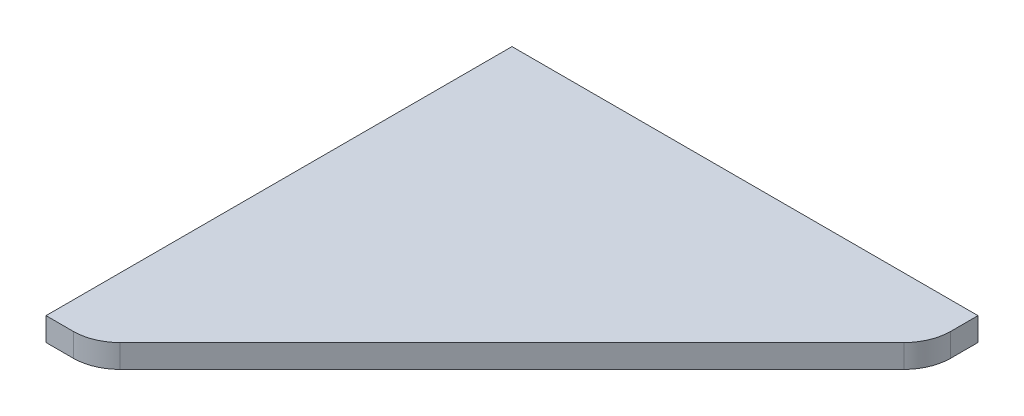
from build123d import *

# Parameters (mm, degrees)
SKETCH2_W                      = 304.8
SKETCH2_H                      = 304.8
BOSS_EXTRUDE1_DEPTH            = 3.175
CUT_EXTRUDE1_DEPTH             = 348.408852067
CUT_EXTRUDE1_DEPTH_BACK        = 348.408852067
SKETCH3_W                      = 304.8
SKETCH3_H                      = 304.8
SKETCH3_R                      = 12.7
SKETCH3_R_2                    = 8.89
BODY_DELETE_KEEP_1_OUTLINE_R   = 12.7
BODY_DELETE_KEEP_1_OUTLINE_R_2 = 8.89
BODY_DELETE_KEEP_1_DEPTH       = 3.175


# Read off the part's stored shape, not the designer's step: Body-Delete/Keep 1
with BuildPart() as part:
    # Sketch2 → Boss-Extrude1 (new body)
    with BuildSketch(Plane(origin=(0, 0, 0), x_dir=(1, 0, 0), z_dir=(0, 1, 0))):
        with Locations((-56.763509666, -124.968808797)):
            Rectangle(SKETCH2_W, SKETCH2_H)
    extrude(amount=BOSS_EXTRUDE1_DEPTH)

    # Sketch3 → Cut-Extrude1 (cut, two sides: drawn at the far end of the back side and taken through both)
    # profile 1 of 3: a face of its own
    with BuildSketch(Plane(origin=(0, 3.175, 0), x_dir=(1, 0, 0), z_dir=(0, 1, 0)).offset(-CUT_EXTRUDE1_DEPTH_BACK)):
        with Locations((-56.763509666, -124.968808797)):
            Rectangle(SKETCH3_W, SKETCH3_H)
        Polygon((-188.253637726, -268.695366412), (-192.063637726, -268.695366412), (-192.063637726, -265.393366412), (-198.413637726, -265.393366412), (-188.253637726, -205.195366412), align=None, mode=Mode.SUBTRACT)
        Polygon((-185.713637726, -265.393366412), (-175.553637726, -205.195366412), (-175.553637726, -268.695366412), (-179.363637726, -268.695366412), (-179.363637726, -265.393366412), align=None, mode=Mode.SUBTRACT)
        Polygon((-162.853637726, -268.695366412), (-166.663637726, -268.695366412), (-166.663637726, -265.393366412), (-173.013637726, -265.393366412), (-162.853637726, -205.195366412), align=None, mode=Mode.SUBTRACT)
        Polygon((-150.153637726, -268.695366412), (-153.963637726, -268.695366412), (-153.963637726, -265.393366412), (-160.313637726, -265.393366412), (-150.153637726, -205.195366412), align=None, mode=Mode.SUBTRACT)
        Polygon((-147.613637726, -265.393366412), (-137.453637726, -205.195366412), (-137.453637726, -268.695366412), (-141.263637726, -268.695366412), (-141.263637726, -265.393366412), align=None, mode=Mode.SUBTRACT)
        Polygon((-128.563637726, -265.393366412), (-134.913637726, -265.393366412), (-124.753637726, -205.195366412), (-124.753637726, -268.695366412), (-128.563637726, -268.695366412), align=None, mode=Mode.SUBTRACT)
        Polygon((-122.213637726, -265.393366412), (-112.053637726, -205.195366412), (-112.053637726, -268.695366412), (-115.863637726, -268.695366412), (-115.863637726, -265.393366412), align=None, mode=Mode.SUBTRACT)
        Polygon((-99.353637726, -268.695366412), (-103.163637726, -268.695366412), (-103.163637726, -265.393366412), (-109.513637726, -265.393366412), (-99.353637726, -205.195366412), align=None, mode=Mode.SUBTRACT)
        Polygon((-90.463637726, -268.695366412), (-90.463637726, -265.393366412), (-96.813637726, -265.393366412), (-86.653637726, -205.195366412), (-86.653637726, -268.695366412), align=None, mode=Mode.SUBTRACT)
        Polygon((-84.113637726, -265.393366412), (-73.953637726, -205.195366412), (-73.953637726, -268.695366412), (-77.763637726, -268.695366412), (-77.763637726, -265.393366412), align=None, mode=Mode.SUBTRACT)
        Polygon((-71.413637726, -265.393366412), (-61.253637726, -205.195366412), (-61.253637726, -268.695366412), (-65.063637726, -268.695366412), (-65.063637726, -265.393366412), align=None, mode=Mode.SUBTRACT)
        with BuildLine():
            ThreePointArc((-132.963509666, -135.600090559), (-133.446874634, -138.030130355), (-134.823381605, -140.09021862))
            Line((-134.823381605, -140.09021862), (-188.253637726, -193.520474741))
            ThreePointArc((-188.253637726, -193.520474741), (-190.313725991, -194.896981712), (-192.743765787, -195.38034668))
            Line((-192.743765787, -195.38034668), (-196.463509666, -195.38034668))
            Line((-196.463509666, -195.38034668), (-196.463509666, -131.88034668))
            Line((-196.463509666, -131.88034668), (-132.963509666, -131.88034668))
            Line((-132.963509666, -131.88034668), (-132.963509666, -135.600090559))
        make_face(mode=Mode.SUBTRACT)
        with BuildLine():
            Line((-126.613509666, -195.38034668), (-126.613509666, -131.88034668))
            Line((-126.613509666, -131.88034668), (-63.113509666, -131.88034668))
            Line((-63.113509666, -131.88034668), (-63.113509666, -135.600090559))
            ThreePointArc((-63.113509666, -135.600090559), (-63.596874634, -138.030130355), (-64.973381605, -140.09021862))
            Line((-64.973381605, -140.09021862), (-118.403637726, -193.520474741))
            ThreePointArc((-118.403637726, -193.520474741), (-120.463725991, -194.896981712), (-122.893765787, -195.38034668))
            Line((-122.893765787, -195.38034668), (-126.613509666, -195.38034668))
        make_face(mode=Mode.SUBTRACT)
        Polygon((-52.363637726, -268.695366412), (-52.363637726, -265.393366412), (-58.713637726, -265.393366412), (-48.553637726, -205.195366412), (-48.553637726, -268.695366412), align=None, mode=Mode.SUBTRACT)
        Polygon((-35.853637726, -205.195366412), (-35.853637726, -268.695366412), (-39.663637726, -268.695366412), (-39.663637726, -265.393366412), (-46.013637726, -265.393366412), align=None, mode=Mode.SUBTRACT)
        Polygon((-23.153637726, -205.195366412), (-23.153637726, -268.695366412), (-26.963637726, -268.695366412), (-26.963637726, -265.393366412), (-33.313637726, -265.393366412), align=None, mode=Mode.SUBTRACT)
        Polygon((-20.613637726, -265.393366412), (-10.453637726, -205.195366412), (-10.453637726, -268.695366412), (-14.263637726, -268.695366412), (-14.263637726, -265.393366412), align=None, mode=Mode.SUBTRACT)
        Polygon((-1.563637726, -268.695366412), (-1.563637726, -265.393366412), (-7.913637726, -265.393366412), (2.246362274, -205.195366412), (2.246362274, -268.695366412), align=None, mode=Mode.SUBTRACT)
        with BuildLine():
            Line((-53.043765787, -195.38034668), (-56.763509666, -195.38034668))
            Line((-56.763509666, -195.38034668), (-56.763509666, -131.88034668))
            Line((-56.763509666, -131.88034668), (6.736490334, -131.88034668))
            Line((6.736490334, -131.88034668), (6.736490334, -135.600090559))
            ThreePointArc((6.736490334, -135.600090559), (6.253125366, -138.030130355), (4.876618395, -140.09021862))
            Line((4.876618395, -140.09021862), (-48.553637726, -193.520474741))
            ThreePointArc((-48.553637726, -193.520474741), (-50.613725991, -194.896981712), (-53.043765787, -195.38034668))
        make_face(mode=Mode.SUBTRACT)
        with BuildLine():
            Line((13.086490334, -131.88034668), (76.586490334, -131.88034668))
            Line((76.586490334, -131.88034668), (76.586490334, -135.600090559))
            ThreePointArc((76.586490334, -135.600090559), (76.103125366, -138.030130355), (74.726618395, -140.09021862))
            Line((74.726618395, -140.09021862), (21.296362274, -193.520474741))
            ThreePointArc((21.296362274, -193.520474741), (19.236274009, -194.896981712), (16.806234213, -195.38034668))
            Line((16.806234213, -195.38034668), (13.086490334, -195.38034668))
            Line((13.086490334, -195.38034668), (13.086490334, -131.88034668))
        make_face(mode=Mode.SUBTRACT)
        with BuildLine():
            Line((-196.463509666, -125.53034668), (-196.463509666, -62.03034668))
            Line((-196.463509666, -62.03034668), (-132.963509666, -62.03034668))
            Line((-132.963509666, -62.03034668), (-132.963509666, -65.750090559))
            ThreePointArc((-132.963509666, -65.750090559), (-133.10773728, -67.095783354), (-133.533868437, -68.38034668))
            ThreePointArc((-133.533868437, -68.38034668), (-134.095097913, -69.368194866), (-134.823381605, -70.24021862))
            Line((-134.823381605, -70.24021862), (-188.253637726, -123.670474741))
            ThreePointArc((-188.253637726, -123.670474741), (-189.12566148, -124.398758433), (-190.113509666, -124.959987909))
            ThreePointArc((-190.113509666, -124.959987909), (-191.398072992, -125.386119066), (-192.743765787, -125.53034668))
            Line((-192.743765787, -125.53034668), (-196.463509666, -125.53034668))
        make_face(mode=Mode.SUBTRACT)
        with BuildLine():
            Line((-122.893765787, -125.53034668), (-126.613509666, -125.53034668))
            Line((-126.613509666, -125.53034668), (-126.613509666, -62.03034668))
            Line((-126.613509666, -62.03034668), (-63.113509666, -62.03034668))
            Line((-63.113509666, -62.03034668), (-63.113509666, -65.750090559))
            ThreePointArc((-63.113509666, -65.750090559), (-63.596874634, -68.180130355), (-64.973381605, -70.24021862))
            Line((-64.973381605, -70.24021862), (-118.403637726, -123.670474741))
            ThreePointArc((-118.403637726, -123.670474741), (-120.463725991, -125.046981712), (-122.893765787, -125.53034668))
        make_face(mode=Mode.SUBTRACT)
        Polygon((-196.463509666, -48.768808797), (-196.463509666, 14.731191203), (-192.653509666, 14.731191203), (-192.653509666, 11.429191203), (-186.303509666, 11.429191203), align=None, mode=Mode.SUBTRACT)
        Polygon((-183.763509666, 14.731191203), (-179.953509666, 14.731191203), (-179.953509666, 11.429191203), (-173.603509666, 11.429191203), (-183.763509666, -48.768808797), align=None, mode=Mode.SUBTRACT)
        Polygon((-171.063509666, 14.731191203), (-167.253509666, 14.731191203), (-167.253509666, 11.429191203), (-160.903509666, 11.429191203), (-171.063509666, -48.768808797), align=None, mode=Mode.SUBTRACT)
        Polygon((-158.363509666, 14.731191203), (-154.553509666, 14.731191203), (-154.553509666, 11.429191203), (-148.203509666, 11.429191203), (-158.363509666, -48.768808797), align=None, mode=Mode.SUBTRACT)
        Polygon((-145.663509666, 14.731191203), (-141.853509666, 14.731191203), (-141.853509666, 11.429191203), (-135.503509666, 11.429191203), (-145.663509666, -48.768808797), align=None, mode=Mode.SUBTRACT)
        Polygon((-132.963509666, 14.731191203), (-129.153509666, 14.731191203), (-129.153509666, 11.429191203), (-122.803509666, 11.429191203), (-132.963509666, -48.768808797), align=None, mode=Mode.SUBTRACT)
        Polygon((-120.263509666, 14.731191203), (-116.453509666, 14.731191203), (-116.453509666, 11.429191203), (-110.103509666, 11.429191203), (-120.263509666, -48.768808797), align=None, mode=Mode.SUBTRACT)
        Polygon((-107.563509666, 14.731191203), (-103.753509666, 14.731191203), (-103.753509666, 11.429191203), (-97.403509666, 11.429191203), (-107.563509666, -48.768808797), align=None, mode=Mode.SUBTRACT)
        Polygon((-94.863509666, 14.731191203), (-91.053509666, 14.731191203), (-91.053509666, 11.429191203), (-84.703509666, 11.429191203), (-94.863509666, -48.768808797), align=None, mode=Mode.SUBTRACT)
        Polygon((-82.163509666, 14.731191203), (-78.353509666, 14.731191203), (-78.353509666, 11.429191203), (-72.003509666, 11.429191203), (-82.163509666, -48.768808797), align=None, mode=Mode.SUBTRACT)
        Polygon((-69.463509666, 14.731191203), (-65.653509666, 14.731191203), (-65.653509666, 11.429191203), (-59.303509666, 11.429191203), (-69.463509666, -48.768808797), align=None, mode=Mode.SUBTRACT)
        with BuildLine():
            Line((-53.043765787, -125.53034668), (-56.763509666, -125.53034668))
            Line((-56.763509666, -125.53034668), (-56.763509666, -62.03034668))
            Line((-56.763509666, -62.03034668), (6.736490334, -62.03034668))
            Line((6.736490334, -62.03034668), (6.736490334, -65.750090559))
            ThreePointArc((6.736490334, -65.750090559), (6.253125366, -68.180130355), (4.876618395, -70.24021862))
            Line((4.876618395, -70.24021862), (-48.553637726, -123.670474741))
            ThreePointArc((-48.553637726, -123.670474741), (-50.613725991, -125.046981712), (-53.043765787, -125.53034668))
        make_face(mode=Mode.SUBTRACT)
        with BuildLine():
            Line((16.806234213, -125.53034668), (13.086490334, -125.53034668))
            Line((13.086490334, -125.53034668), (13.086490334, -62.03034668))
            Line((13.086490334, -62.03034668), (76.586490334, -62.03034668))
            Line((76.586490334, -62.03034668), (76.586490334, -65.750090559))
            ThreePointArc((76.586490334, -65.750090559), (76.103125366, -68.180130355), (74.726618395, -70.24021862))
            Line((74.726618395, -70.24021862), (21.296362274, -123.670474741))
            ThreePointArc((21.296362274, -123.670474741), (19.236274009, -125.046981712), (16.806234213, -125.53034668))
        make_face(mode=Mode.SUBTRACT)
        Polygon((-56.763509666, 14.731191203), (-52.953509666, 14.731191203), (-52.953509666, 11.429191203), (-46.603509666, 11.429191203), (-56.763509666, -48.768808797), align=None, mode=Mode.SUBTRACT)
        Polygon((-44.063509666, 14.731191203), (-40.253509666, 14.731191203), (-40.253509666, 11.429191203), (-33.903509666, 11.429191203), (-44.063509666, -48.768808797), align=None, mode=Mode.SUBTRACT)
        Polygon((-31.363509666, 14.731191203), (-27.553509666, 14.731191203), (-27.553509666, 11.429191203), (-21.203509666, 11.429191203), (-31.363509666, -48.768808797), align=None, mode=Mode.SUBTRACT)
        Polygon((-18.663509666, 14.731191203), (-14.853509666, 14.731191203), (-14.853509666, 11.429191203), (-8.503509666, 11.429191203), (-18.663509666, -48.768808797), align=None, mode=Mode.SUBTRACT)
        Polygon((-5.963509666, 14.731191203), (-2.153509666, 14.731191203), (-2.153509666, 11.429191203), (4.196490334, 11.429191203), (-5.963509666, -48.768808797), align=None, mode=Mode.SUBTRACT)
        Polygon((57.536490334, -48.768808797), (57.536490334, -52.070808797), (32.136490334, -52.070808797), (32.136490334, -48.768808797), (28.834490334, -48.768808797), (28.834490334, -23.368808797), (32.136490334, -23.368808797), (32.136490334, -20.066808797), (57.536490334, -20.066808797), (57.536490334, -23.368808797), (60.838490334, -23.368808797), (60.838490334, -48.768808797), align=None, mode=Mode.SUBTRACT)
        Polygon((28.834490334, 14.731191203), (32.136490334, 14.731191203), (32.136490334, 18.033191203), (57.536490334, 18.033191203), (57.536490334, 14.731191203), (60.838490334, 14.731191203), (60.838490334, -10.668808797), (57.536490334, -10.668808797), (57.536490334, -13.970808797), (32.136490334, -13.970808797), (32.136490334, -10.668808797), (28.834490334, -10.668808797), align=None, mode=Mode.SUBTRACT)
    # profile 2 of 3: a face of its own
    with BuildSketch(Plane(origin=(0, 3.175, 0), x_dir=(1, 0, 0), z_dir=(0, 1, 0)).offset(-CUT_EXTRUDE1_DEPTH_BACK)):
        with Locations(Location((44.836490334, -36.068808797, 0), (0, 0, 270))):
            Circle(SKETCH3_R)
    # profile 3 of 3: a face of its own
    with BuildSketch(Plane(origin=(0, 3.175, 0), x_dir=(1, 0, 0), z_dir=(0, 1, 0)).offset(-CUT_EXTRUDE1_DEPTH_BACK)):
        with Locations(Location((44.836490334, 2.031191203, 0), (0, 0, 270))):
            Circle(SKETCH3_R_2)
    extrude(amount=CUT_EXTRUDE1_DEPTH + CUT_EXTRUDE1_DEPTH_BACK, mode=Mode.SUBTRACT)

    # Body-Delete/Keep 1 outline → Body-Delete/Keep 1 (cut)
    # profile 1 of 41: a face of its own
    with BuildSketch(Plane(origin=(0, 0, 0), x_dir=(1, 0, 0), z_dir=(0, 1, 0))):
        with BuildLine():
            Line((-126.613509666, -62.03034668), (-126.613509666, -125.53034668))
            Line((-126.613509666, -125.53034668), (-122.893765787, -125.53034668))
            ThreePointArc((-122.893765787, -125.53034668), (-120.463725991, -125.046981712), (-118.403637726, -123.670474741))
            Line((-118.403637726, -123.670474741), (-64.973381605, -70.24021862))
            ThreePointArc((-64.973381605, -70.24021862), (-63.596874634, -68.180130355), (-63.113509666, -65.750090559))
            Line((-63.113509666, -65.750090559), (-63.113509666, -62.03034668))
            Line((-63.113509666, -62.03034668), (-126.613509666, -62.03034668))
        make_face()
    # profile 2 of 41: a face of its own
    with BuildSketch(Plane(origin=(0, 0, 0), x_dir=(1, 0, 0), z_dir=(0, 1, 0))):
        with BuildLine():
            Line((-56.763509666, -62.03034668), (-56.763509666, -125.53034668))
            Line((-56.763509666, -125.53034668), (-53.043765787, -125.53034668))
            ThreePointArc((-53.043765787, -125.53034668), (-50.613725991, -125.046981712), (-48.553637726, -123.670474741))
            Line((-48.553637726, -123.670474741), (4.876618395, -70.24021862))
            ThreePointArc((4.876618395, -70.24021862), (6.253125366, -68.180130355), (6.736490334, -65.750090559))
            Line((6.736490334, -65.750090559), (6.736490334, -62.03034668))
            Line((6.736490334, -62.03034668), (-56.763509666, -62.03034668))
        make_face()
    # profile 3 of 41: a face of its own
    with BuildSketch(Plane(origin=(0, 0, 0), x_dir=(1, 0, 0), z_dir=(0, 1, 0))):
        with BuildLine():
            Line((13.086490334, -62.03034668), (13.086490334, -125.53034668))
            Line((13.086490334, -125.53034668), (16.806234213, -125.53034668))
            ThreePointArc((16.806234213, -125.53034668), (19.236274009, -125.046981712), (21.296362274, -123.670474741))
            Line((21.296362274, -123.670474741), (74.726618395, -70.24021862))
            ThreePointArc((74.726618395, -70.24021862), (76.103125366, -68.180130355), (76.586490334, -65.750090559))
            Line((76.586490334, -65.750090559), (76.586490334, -62.03034668))
            Line((76.586490334, -62.03034668), (13.086490334, -62.03034668))
        make_face()
    # profile 4 of 41: a face of its own
    with BuildSketch(Plane(origin=(0, 0, 0), x_dir=(1, 0, 0), z_dir=(0, 1, 0))):
        Polygon((-192.653509666, 14.731191203), (-196.463509666, 14.731191203), (-196.463509666, -48.768808797), (-186.303509666, 11.429191203), (-192.653509666, 11.429191203), align=None)
    # profile 5 of 41: a face of its own
    with BuildSketch(Plane(origin=(0, 0, 0), x_dir=(1, 0, 0), z_dir=(0, 1, 0))):
        with BuildLine():
            Line((-132.963509666, -131.88034668), (-196.463509666, -131.88034668))
            Line((-196.463509666, -131.88034668), (-196.463509666, -195.38034668))
            Line((-196.463509666, -195.38034668), (-192.743765787, -195.38034668))
            ThreePointArc((-192.743765787, -195.38034668), (-190.313725991, -194.896981712), (-188.253637726, -193.520474741))
            Line((-188.253637726, -193.520474741), (-134.823381605, -140.09021862))
            ThreePointArc((-134.823381605, -140.09021862), (-133.446874634, -138.030130355), (-132.963509666, -135.600090559))
            Line((-132.963509666, -135.600090559), (-132.963509666, -131.88034668))
        make_face()
    # profile 6 of 41: a face of its own
    with BuildSketch(Plane(origin=(0, 0, 0), x_dir=(1, 0, 0), z_dir=(0, 1, 0))):
        Polygon((32.136490334, -20.066808797), (32.136490334, -23.368808797), (28.834490334, -23.368808797), (28.834490334, -48.768808797), (32.136490334, -48.768808797), (32.136490334, -52.070808797), (57.536490334, -52.070808797), (57.536490334, -48.768808797), (60.838490334, -48.768808797), (60.838490334, -23.368808797), (57.536490334, -23.368808797), (57.536490334, -20.066808797), align=None)
        with Locations((44.836490334, -36.068808797)):
            Circle(BODY_DELETE_KEEP_1_OUTLINE_R, mode=Mode.SUBTRACT)
    # profile 7 of 41: a face of its own
    with BuildSketch(Plane(origin=(0, 0, 0), x_dir=(1, 0, 0), z_dir=(0, 1, 0))):
        Polygon((28.834490334, -10.668808797), (32.136490334, -10.668808797), (32.136490334, -13.970808797), (57.536490334, -13.970808797), (57.536490334, -10.668808797), (60.838490334, -10.668808797), (60.838490334, 14.731191203), (57.536490334, 14.731191203), (57.536490334, 18.033191203), (32.136490334, 18.033191203), (32.136490334, 14.731191203), (28.834490334, 14.731191203), align=None)
        with Locations((44.836490334, 2.031191203)):
            Circle(BODY_DELETE_KEEP_1_OUTLINE_R_2, mode=Mode.SUBTRACT)
    # profile 8 of 41: a face of its own
    with BuildSketch(Plane(origin=(0, 0, 0), x_dir=(1, 0, 0), z_dir=(0, 1, 0))):
        Polygon((-2.153509666, 11.429191203), (-2.153509666, 14.731191203), (-5.963509666, 14.731191203), (-5.963509666, -48.768808797), (4.196490334, 11.429191203), align=None)
    # profile 9 of 41: a face of its own
    with BuildSketch(Plane(origin=(0, 0, 0), x_dir=(1, 0, 0), z_dir=(0, 1, 0))):
        Polygon((-27.553509666, 11.429191203), (-27.553509666, 14.731191203), (-31.363509666, 14.731191203), (-31.363509666, -48.768808797), (-21.203509666, 11.429191203), align=None)
    # profile 10 of 41: a face of its own
    with BuildSketch(Plane(origin=(0, 0, 0), x_dir=(1, 0, 0), z_dir=(0, 1, 0))):
        Polygon((-14.853509666, 11.429191203), (-14.853509666, 14.731191203), (-18.663509666, 14.731191203), (-18.663509666, -48.768808797), (-8.503509666, 11.429191203), align=None)
    # profile 11 of 41: a face of its own
    with BuildSketch(Plane(origin=(0, 0, 0), x_dir=(1, 0, 0), z_dir=(0, 1, 0))):
        Polygon((-65.653509666, 11.429191203), (-65.653509666, 14.731191203), (-69.463509666, 14.731191203), (-69.463509666, -48.768808797), (-59.303509666, 11.429191203), align=None)
    # profile 12 of 41: a face of its own
    with BuildSketch(Plane(origin=(0, 0, 0), x_dir=(1, 0, 0), z_dir=(0, 1, 0))):
        Polygon((-91.053509666, 11.429191203), (-91.053509666, 14.731191203), (-94.863509666, 14.731191203), (-94.863509666, -48.768808797), (-84.703509666, 11.429191203), align=None)
    # profile 13 of 41: a face of its own
    with BuildSketch(Plane(origin=(0, 0, 0), x_dir=(1, 0, 0), z_dir=(0, 1, 0))):
        Polygon((-40.253509666, 11.429191203), (-40.253509666, 14.731191203), (-44.063509666, 14.731191203), (-44.063509666, -48.768808797), (-33.903509666, 11.429191203), align=None)
    # profile 14 of 41: a face of its own
    with BuildSketch(Plane(origin=(0, 0, 0), x_dir=(1, 0, 0), z_dir=(0, 1, 0))):
        Polygon((-52.953509666, 11.429191203), (-52.953509666, 14.731191203), (-56.763509666, 14.731191203), (-56.763509666, -48.768808797), (-46.603509666, 11.429191203), align=None)
    # profile 15 of 41: a face of its own
    with BuildSketch(Plane(origin=(0, 0, 0), x_dir=(1, 0, 0), z_dir=(0, 1, 0))):
        Polygon((-141.853509666, 11.429191203), (-141.853509666, 14.731191203), (-145.663509666, 14.731191203), (-145.663509666, -48.768808797), (-135.503509666, 11.429191203), align=None)
    # profile 16 of 41: a face of its own
    with BuildSketch(Plane(origin=(0, 0, 0), x_dir=(1, 0, 0), z_dir=(0, 1, 0))):
        Polygon((-154.553509666, 11.429191203), (-154.553509666, 14.731191203), (-158.363509666, 14.731191203), (-158.363509666, -48.768808797), (-148.203509666, 11.429191203), align=None)
    # profile 17 of 41: a face of its own
    with BuildSketch(Plane(origin=(0, 0, 0), x_dir=(1, 0, 0), z_dir=(0, 1, 0))):
        Polygon((-167.253509666, 11.429191203), (-167.253509666, 14.731191203), (-171.063509666, 14.731191203), (-171.063509666, -48.768808797), (-160.903509666, 11.429191203), align=None)
    # profile 18 of 41: a face of its own
    with BuildSketch(Plane(origin=(0, 0, 0), x_dir=(1, 0, 0), z_dir=(0, 1, 0))):
        Polygon((-78.353509666, 11.429191203), (-78.353509666, 14.731191203), (-82.163509666, 14.731191203), (-82.163509666, -48.768808797), (-72.003509666, 11.429191203), align=None)
    # profile 19 of 41: a face of its own
    with BuildSketch(Plane(origin=(0, 0, 0), x_dir=(1, 0, 0), z_dir=(0, 1, 0))):
        Polygon((-179.953509666, 11.429191203), (-179.953509666, 14.731191203), (-183.763509666, 14.731191203), (-183.763509666, -48.768808797), (-173.603509666, 11.429191203), align=None)
    # profile 20 of 41: a face of its own
    with BuildSketch(Plane(origin=(0, 0, 0), x_dir=(1, 0, 0), z_dir=(0, 1, 0))):
        Polygon((-103.753509666, 11.429191203), (-103.753509666, 14.731191203), (-107.563509666, 14.731191203), (-107.563509666, -48.768808797), (-97.403509666, 11.429191203), align=None)
    # profile 21 of 41: a face of its own
    with BuildSketch(Plane(origin=(0, 0, 0), x_dir=(1, 0, 0), z_dir=(0, 1, 0))):
        Polygon((-116.453509666, 11.429191203), (-116.453509666, 14.731191203), (-120.263509666, 14.731191203), (-120.263509666, -48.768808797), (-110.103509666, 11.429191203), align=None)
    # profile 22 of 41: a face of its own
    with BuildSketch(Plane(origin=(0, 0, 0), x_dir=(1, 0, 0), z_dir=(0, 1, 0))):
        Polygon((-129.153509666, 11.429191203), (-129.153509666, 14.731191203), (-132.963509666, 14.731191203), (-132.963509666, -48.768808797), (-122.803509666, 11.429191203), align=None)
    # profile 23 of 41: a face of its own
    with BuildSketch(Plane(origin=(0, 0, 0), x_dir=(1, 0, 0), z_dir=(0, 1, 0))):
        Polygon((-71.413637726, -265.393366412), (-65.063637726, -265.393366412), (-65.063637726, -268.695366412), (-61.253637726, -268.695366412), (-61.253637726, -205.195366412), align=None)
    # profile 24 of 41: a face of its own
    with BuildSketch(Plane(origin=(0, 0, 0), x_dir=(1, 0, 0), z_dir=(0, 1, 0))):
        Polygon((-124.753637726, -205.195366412), (-134.913637726, -265.393366412), (-128.563637726, -265.393366412), (-128.563637726, -268.695366412), (-124.753637726, -268.695366412), align=None)
    # profile 25 of 41: a face of its own
    with BuildSketch(Plane(origin=(0, 0, 0), x_dir=(1, 0, 0), z_dir=(0, 1, 0))):
        Polygon((-23.153637726, -205.195366412), (-33.313637726, -265.393366412), (-26.963637726, -265.393366412), (-26.963637726, -268.695366412), (-23.153637726, -268.695366412), align=None)
    # profile 26 of 41: a face of its own
    with BuildSketch(Plane(origin=(0, 0, 0), x_dir=(1, 0, 0), z_dir=(0, 1, 0))):
        Polygon((-35.853637726, -205.195366412), (-46.013637726, -265.393366412), (-39.663637726, -265.393366412), (-39.663637726, -268.695366412), (-35.853637726, -268.695366412), align=None)
    # profile 27 of 41: a face of its own
    with BuildSketch(Plane(origin=(0, 0, 0), x_dir=(1, 0, 0), z_dir=(0, 1, 0))):
        Polygon((-73.953637726, -205.195366412), (-84.113637726, -265.393366412), (-77.763637726, -265.393366412), (-77.763637726, -268.695366412), (-73.953637726, -268.695366412), align=None)
    # profile 28 of 41: a face of its own
    with BuildSketch(Plane(origin=(0, 0, 0), x_dir=(1, 0, 0), z_dir=(0, 1, 0))):
        Polygon((-162.853637726, -205.195366412), (-173.013637726, -265.393366412), (-166.663637726, -265.393366412), (-166.663637726, -268.695366412), (-162.853637726, -268.695366412), align=None)
    # profile 29 of 41: a face of its own
    with BuildSketch(Plane(origin=(0, 0, 0), x_dir=(1, 0, 0), z_dir=(0, 1, 0))):
        Polygon((-188.253637726, -205.195366412), (-198.413637726, -265.393366412), (-192.063637726, -265.393366412), (-192.063637726, -268.695366412), (-188.253637726, -268.695366412), align=None)
    # profile 30 of 41: a face of its own
    with BuildSketch(Plane(origin=(0, 0, 0), x_dir=(1, 0, 0), z_dir=(0, 1, 0))):
        Polygon((-175.553637726, -205.195366412), (-185.713637726, -265.393366412), (-179.363637726, -265.393366412), (-179.363637726, -268.695366412), (-175.553637726, -268.695366412), align=None)
    # profile 31 of 41: a face of its own
    with BuildSketch(Plane(origin=(0, 0, 0), x_dir=(1, 0, 0), z_dir=(0, 1, 0))):
        Polygon((-150.153637726, -205.195366412), (-160.313637726, -265.393366412), (-153.963637726, -265.393366412), (-153.963637726, -268.695366412), (-150.153637726, -268.695366412), align=None)
    # profile 32 of 41: a face of its own
    with BuildSketch(Plane(origin=(0, 0, 0), x_dir=(1, 0, 0), z_dir=(0, 1, 0))):
        Polygon((-86.653637726, -205.195366412), (-96.813637726, -265.393366412), (-90.463637726, -265.393366412), (-90.463637726, -268.695366412), (-86.653637726, -268.695366412), align=None)
    # profile 33 of 41: a face of its own
    with BuildSketch(Plane(origin=(0, 0, 0), x_dir=(1, 0, 0), z_dir=(0, 1, 0))):
        Polygon((2.246362274, -205.195366412), (-7.913637726, -265.393366412), (-1.563637726, -265.393366412), (-1.563637726, -268.695366412), (2.246362274, -268.695366412), align=None)
    # profile 34 of 41: a face of its own
    with BuildSketch(Plane(origin=(0, 0, 0), x_dir=(1, 0, 0), z_dir=(0, 1, 0))):
        Polygon((-137.453637726, -205.195366412), (-147.613637726, -265.393366412), (-141.263637726, -265.393366412), (-141.263637726, -268.695366412), (-137.453637726, -268.695366412), align=None)
    # profile 35 of 41: a face of its own
    with BuildSketch(Plane(origin=(0, 0, 0), x_dir=(1, 0, 0), z_dir=(0, 1, 0))):
        Polygon((-48.553637726, -205.195366412), (-58.713637726, -265.393366412), (-52.363637726, -265.393366412), (-52.363637726, -268.695366412), (-48.553637726, -268.695366412), align=None)
    # profile 36 of 41: a face of its own
    with BuildSketch(Plane(origin=(0, 0, 0), x_dir=(1, 0, 0), z_dir=(0, 1, 0))):
        Polygon((-10.453637726, -205.195366412), (-20.613637726, -265.393366412), (-14.263637726, -265.393366412), (-14.263637726, -268.695366412), (-10.453637726, -268.695366412), align=None)
    # profile 37 of 41: a face of its own
    with BuildSketch(Plane(origin=(0, 0, 0), x_dir=(1, 0, 0), z_dir=(0, 1, 0))):
        Polygon((-99.353637726, -205.195366412), (-109.513637726, -265.393366412), (-103.163637726, -265.393366412), (-103.163637726, -268.695366412), (-99.353637726, -268.695366412), align=None)
    # profile 38 of 41: a face of its own
    with BuildSketch(Plane(origin=(0, 0, 0), x_dir=(1, 0, 0), z_dir=(0, 1, 0))):
        Polygon((-112.053637726, -205.195366412), (-122.213637726, -265.393366412), (-115.863637726, -265.393366412), (-115.863637726, -268.695366412), (-112.053637726, -268.695366412), align=None)
    # profile 39 of 41: a face of its own
    with BuildSketch(Plane(origin=(0, 0, 0), x_dir=(1, 0, 0), z_dir=(0, 1, 0))):
        with BuildLine():
            Line((6.736490334, -131.88034668), (-56.763509666, -131.88034668))
            Line((-56.763509666, -131.88034668), (-56.763509666, -195.38034668))
            Line((-56.763509666, -195.38034668), (-53.043765787, -195.38034668))
            ThreePointArc((-53.043765787, -195.38034668), (-50.613725991, -194.896981712), (-48.553637726, -193.520474741))
            Line((-48.553637726, -193.520474741), (4.876618395, -140.09021862))
            ThreePointArc((4.876618395, -140.09021862), (6.253125366, -138.030130355), (6.736490334, -135.600090559))
            Line((6.736490334, -135.600090559), (6.736490334, -131.88034668))
        make_face()
    # profile 40 of 41: a face of its own
    with BuildSketch(Plane(origin=(0, 0, 0), x_dir=(1, 0, 0), z_dir=(0, 1, 0))):
        with BuildLine():
            Line((21.296362274, -193.520474741), (74.726618395, -140.09021862))
            ThreePointArc((74.726618395, -140.09021862), (76.103125366, -138.030130355), (76.586490334, -135.600090559))
            Line((76.586490334, -135.600090559), (76.586490334, -131.88034668))
            Line((76.586490334, -131.88034668), (13.086490334, -131.88034668))
            Line((13.086490334, -131.88034668), (13.086490334, -195.38034668))
            Line((13.086490334, -195.38034668), (16.806234213, -195.38034668))
            ThreePointArc((16.806234213, -195.38034668), (19.236274009, -194.896981712), (21.296362274, -193.520474741))
        make_face()
    # profile 41 of 41: a face of its own
    with BuildSketch(Plane(origin=(0, 0, 0), x_dir=(1, 0, 0), z_dir=(0, 1, 0))):
        with BuildLine():
            Line((-126.613509666, -131.88034668), (-126.613509666, -195.38034668))
            Line((-126.613509666, -195.38034668), (-122.893765787, -195.38034668))
            ThreePointArc((-122.893765787, -195.38034668), (-120.463725991, -194.896981712), (-118.403637726, -193.520474741))
            Line((-118.403637726, -193.520474741), (-64.973381605, -140.09021862))
            ThreePointArc((-64.973381605, -140.09021862), (-63.596874634, -138.030130355), (-63.113509666, -135.600090559))
            Line((-63.113509666, -135.600090559), (-63.113509666, -131.88034668))
            Line((-63.113509666, -131.88034668), (-126.613509666, -131.88034668))
        make_face()
    extrude(amount=BODY_DELETE_KEEP_1_DEPTH, mode=Mode.SUBTRACT)


solid = part.part
